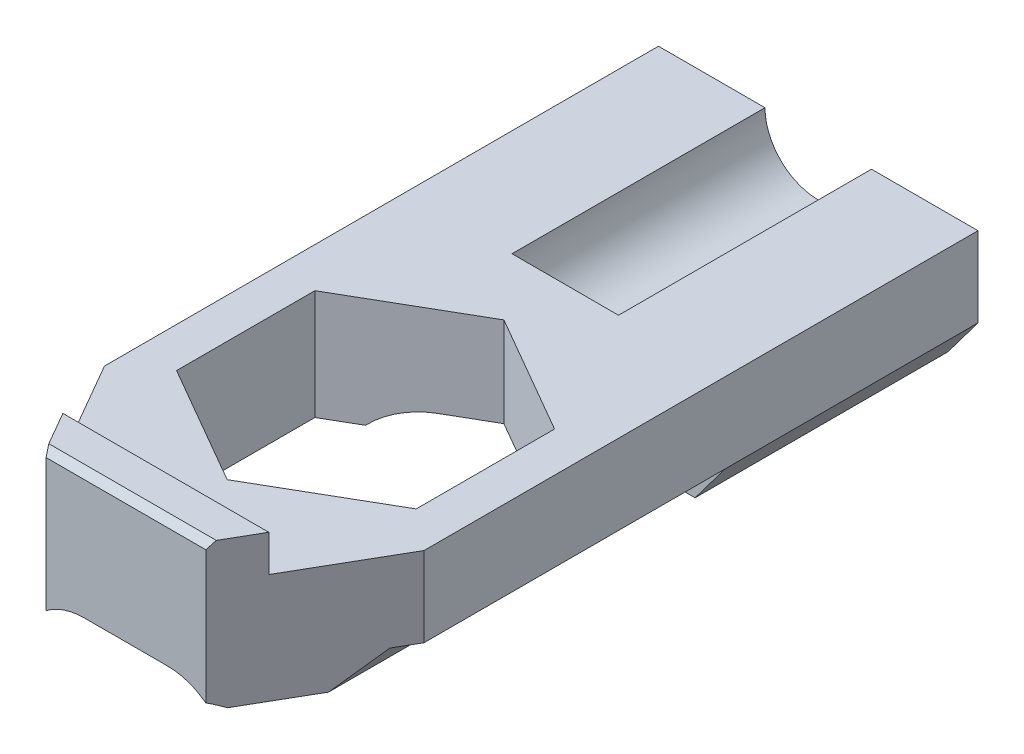
from build123d import *

# Parameters (mm, degrees)
Y_KSEKLIK_EKSTR_ZYON1_DEPTH = 38
RADYUS3_R                   = 8
Y_KSEKLIK_EKSTR_ZYON2_DEPTH = 10
Y_KSEKLIK_EKSTR_ZYON3_DEPTH = 24
KES_EKSTR_ZYON1_DEPTH       = 68
KES_EKSTR_ZYON3_DEPTH       = 68
KES_EKSTR_ZYON3_DEPTH_BACK  = 68
KES_EKSTR_ZYON4_DEPTH       = 68
KES_EKSTR_ZYON7_DEPTH       = 68


with BuildPart() as part:
    # Çizim1 → Yükseklik-Ekstrüzyon1 (new body)
    with BuildSketch(Plane.XY):
        with BuildLine():
            Line((-8, 0), (-24, 0))
            Line((-24, 0), (-24, -12))
            Line((-24, -12), (-19.5, -18))
            Line((-19.5, -18), (-12.5, -18))
            Line((-12.5, -18), (-10.25, -15))
            Line((-10.25, -15), (10.25, -15))
            Line((10.25, -15), (12.5, -18))
            Line((12.5, -18), (19.5, -18))
            Line((19.5, -18), (24, -12))
            Line((24, -12), (24, 0))
            Line((24, 0), (8, 0))
            ThreePointArc((8, 0), (0, -8), (-8, 0))
        make_face()
    extrude(amount=Y_KSEKLIK_EKSTR_ZYON1_DEPTH)

    # Radyus3
    # the kernel refuses this fillet: 8 mm, written as the material it adds along each edge
    with BuildSketch(Plane(origin=(10.25, -15, 0), x_dir=(-1, 0, 0), z_dir=(0, 0, 1))) as radyus3_piece_1:
        with BuildLine():
            CenterArc((3.994997998, 8), RADYUS3_R, 218.682187453, 51.317812547)
            Line((-2.25, 3), (-2.37489996, 2.9))
            ThreePointArc((-2.37489996, 2.9), (-1.253, 1.404), (-0.128, -0.096))
            Line((-0.128, -0.096), (0, -0.16))
            Line((0, -0.16), (3.994997998, -0.16))
            Line((3.994997998, -0.16), (3.994997998, 0))
        make_face()
    extrude(amount=38)
    with BuildSketch(Plane(origin=(-10.25, -15, 0), x_dir=(-0.5999999999999978, -0.8000000000000017, 0), z_dir=(0, 0, 1))) as radyus3_piece_2:
        with BuildLine():
            CenterArc((4.003001201, 7.995998399), RADYUS3_R, 216.869897646, 51.317812547)
            Line((-2.396998799, 3.195998399), (-2.524998799, 3.099998399))
            Line((-2.524998799, 3.099998399), (-0.128, -0.096))
            Line((-0.128, -0.096), (0, -0.16))
            ThreePointArc((0, -0.16), (1.875, -0.16), (3.744939976, -0.159919968))
            Line((3.744939976, -0.159919968), (3.75, 0))
        make_face()
    extrude(amount=38)

    # Çizim2 → Yükseklik-Ekstrüzyon2 (add)
    with BuildSketch(Plane.XY.offset(38)):
        with BuildLine():
            Line((22.125, -12), (24, -12))
            Line((24, -12), (24, 0))
            Line((24, 0), (-24, 0))
            Line((-24, 0), (-24, -12))
            Line((-24, -12), (-22.125, -12))
            Line((-22.125, -12), (-18.75, -16.5))
            Line((-18.75, -16.5), (-13.183205232, -16.5))
            ThreePointArc((-13.183205232, -16.5), (-10.029919219, -14.282202113), (-6.255002002, -13.5))
            Line((-6.255002002, -13.5), (6.255002002, -13.5))
            ThreePointArc((6.255002002, -13.5), (10.029919219, -14.282202113), (13.183205232, -16.5))
            Line((13.183205232, -16.5), (18.75, -16.5))
            Line((18.75, -16.5), (22.125, -12))
        make_face()
    extrude(amount=Y_KSEKLIK_EKSTR_ZYON2_DEPTH)

    # Çizim4 → Yükseklik-Ekstrüzyon3 (add, symmetric)
    with BuildSketch(Plane(origin=(0, 0, 0), x_dir=(0, 0, -1), z_dir=(1, 0, 0))):
        Polygon((-109, -10.5), (-103, -16.5), (-48, -16.5), (-48, 0), (-98, 0), (-98, 5.5), (-103, 5.5), (-109, -0.5), align=None)
    extrude(amount=Y_KSEKLIK_EKSTR_ZYON3_DEPTH, both=True)

    # Çizim5 → Kes-Ekstrüzyon1 (cut)
    with BuildSketch(Plane(origin=(0, 0, 48), x_dir=(-1, 0, 0), z_dir=(0, 0, -1))):
        Polygon((24, -16.5), (24, -12), (22.125, -12), (18.75, -16.5), align=None)
    extrude(amount=-KES_EKSTR_ZYON1_DEPTH, mode=Mode.SUBTRACT)

    # Çizim6 → Kes-Ekstrüzyon3 (cut, two sides: drawn at the far end of the back side and taken through both)
    with BuildSketch(Plane(origin=(0, 0, 0), x_dir=(1, 0, 0), z_dir=(0, 1, 0)).offset(-KES_EKSTR_ZYON3_DEPTH_BACK)):
        Polygon((-24, -83.22), (-34.13268128, -83.22), (-34.13268128, -122.200491655), (32.816911355, -122.200491655), (32.816911355, -83.22), (24, -83.22), (12, -104.004609691), (-12, -104.004609691), align=None)
    extrude(amount=KES_EKSTR_ZYON3_DEPTH + KES_EKSTR_ZYON3_DEPTH_BACK, mode=Mode.SUBTRACT)

    # Çizim7 → Kes-Ekstrüzyon4 (cut)
    with BuildSketch(Plane(origin=(0, 0, 48), x_dir=(-1, 0, 0), z_dir=(0, 0, -1))):
        with BuildLine():
            Line((6.255002002, -13.5), (-6.255002002, -13.5))
            ThreePointArc((-6.255002002, -13.5), (-10.029919219, -14.282202113), (-13.183205232, -16.5))
            Line((-13.183205232, -16.5), (13.183205232, -16.5))
            ThreePointArc((13.183205232, -16.5), (10.029919219, -14.282202113), (6.255002002, -13.5))
        make_face()
        Polygon((-24, -16.5), (-18.75, -16.5), (-22.125, -12), (-24, -12), align=None)
    extrude(amount=-KES_EKSTR_ZYON4_DEPTH, mode=Mode.SUBTRACT)

    # Çizim9 → Kes-Ekstrüzyon7 (cut)
    with BuildSketch(Plane(origin=(0, 0, 0), x_dir=(1, 0, 0), z_dir=(0, 1, 0))):
        Polygon((0, -47.215390309), (-18, -57.607695155), (-18, -78.392304845), (0, -88.784609691), (18, -78.392304845), (18, -57.607695155), align=None)
    extrude(amount=-KES_EKSTR_ZYON7_DEPTH, mode=Mode.SUBTRACT)


solid = part.part
